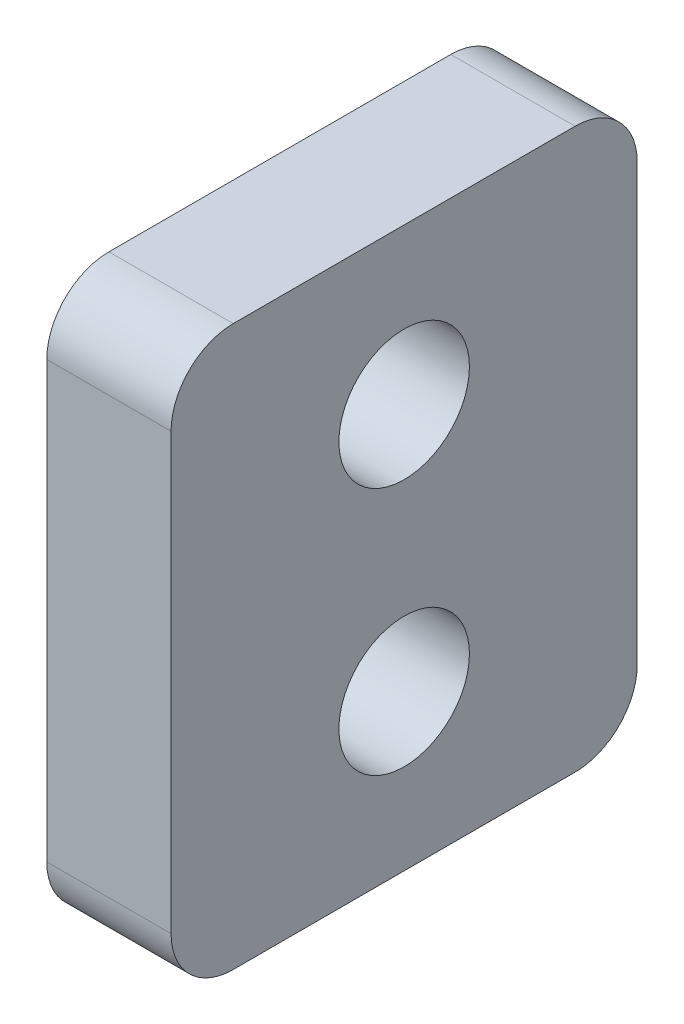
from build123d import *

# Parameters (mm, degrees)
SKETCH4_W           = 15
SKETCH4_H           = 18
SKETCH4_R           = 2.1
BOSS_EXTRUDE1_DEPTH = 4
FILLET1_R           = 2


with BuildPart() as part:
    # Sketch4 → Boss-Extrude1 (new body)
    with BuildSketch(Plane(origin=(0, 0, 0), x_dir=(0, 0, -1), z_dir=(1, 0, 0))):
        Rectangle(SKETCH4_W, SKETCH4_H)
        with Locations((0, 4)):
            Circle(SKETCH4_R, mode=Mode.SUBTRACT)
        with Locations((0, -4)):
            Circle(SKETCH4_R, mode=Mode.SUBTRACT)
    extrude(amount=BOSS_EXTRUDE1_DEPTH)

    # Fillet1
    fillet1_edges = [part.edges().sort_by_distance(p)[0] for p in [
        (2, -9, -7.5),
        (2, -9, 7.5),
        (2, 9, -7.5),
        (2, 9, 7.5),
    ]]
    fillet(fillet1_edges, radius=FILLET1_R)


solid = part.part
